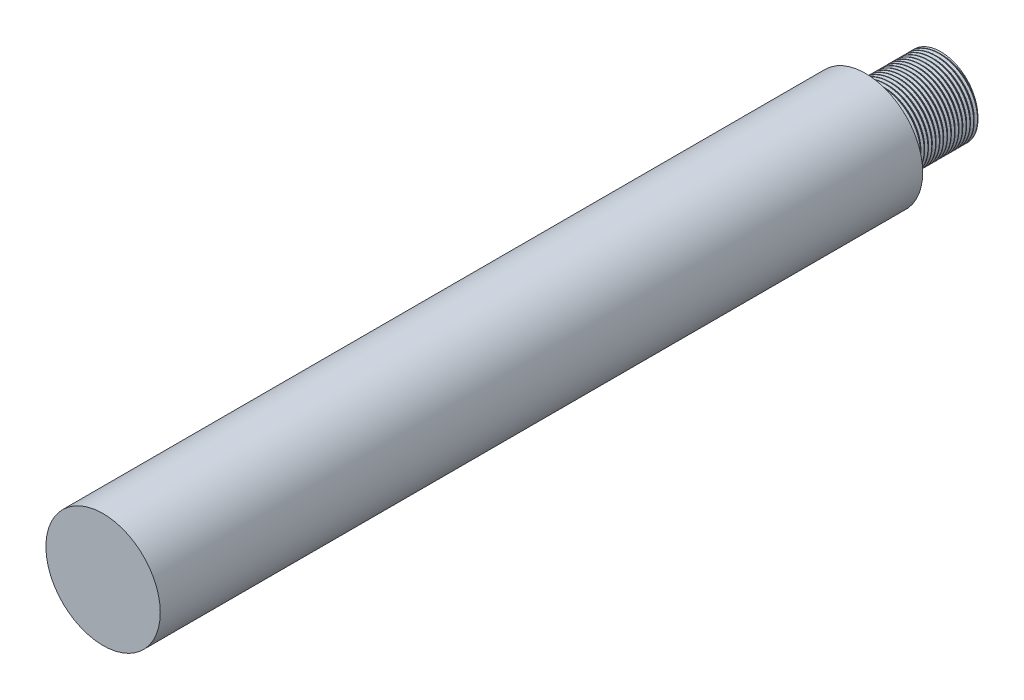
from build123d import *
from build123d.topology import SkipClean

# Parameters (mm, degrees)
SKETCH2_R           = 3.175
BOSS_EXTRUDE1_DEPTH = 6.35
THREAD1_PITCH       = 0.3175
SKETCH5_R           = 4.7625
SKETCH5_R_2         = 3.175
BOSS_EXTRUDE3_DEPTH = 63.5


with BuildPart() as part:
    # Sketch2 → Boss-Extrude1 (new body)
    with BuildSketch(Plane.XY):
        Circle(SKETCH2_R)
    extrude(amount=BOSS_EXTRUDE1_DEPTH)

    # Thread1: the profile of Thread Profile1 profile screwed along a right-hand helix of 20 turns, 6 arcs to a turn; built about Z, then put on its axis
    thread1_z = Axis((0, 0, 0), (0, 0, 1))
    thread1_corners = [(3.1753, 0, -0.000173205), (3.1753, 0, 0.277985704), (3.003148085, 0, 0.17859375), (3.003148085, 0, 0.09921875)]
    with BuildLine(mode=Mode.PRIVATE) as thread1_profile:
        Line(thread1_corners[0], thread1_corners[1])
        Line(thread1_corners[1], thread1_corners[2])
        Line(thread1_corners[2], thread1_corners[3])
        Line(thread1_corners[3], thread1_corners[0])
    thread1_cap = Face(thread1_profile.wire())
    thread1_turn_angles = [0, 30, 60, 90, 120, 150, 180, 210, 240, 270, 300, 330, 360]
    thread1_turn_weights = [1, 0.8660254037844387, 1, 0.8660254037844387, 1, 0.8660254037844387, 1, 0.8660254037844387, 1, 0.8660254037844387, 1, 0.8660254037844387, 1]
    thread1_turn_rails = [Edge.make_bspline([Vector(p[0], p[1], 0).rotate(thread1_z, thread1_turn_angles[k]) / thread1_turn_weights[k] + Vector(0, 0, p[2] + THREAD1_PITCH * thread1_turn_angles[k] / 360) for k in range(13)], [0, 0, 0, 1, 1, 2, 2, 3, 3, 4, 4, 5, 5, 6, 6, 6], 2, thread1_turn_weights) for p in thread1_corners]
    thread1_turn_sides = [Face.make_surface_from_curves(thread1_turn_rails[p[0]], thread1_turn_rails[p[1]]) for p in [(0, 1), (1, 2), (2, 3), (3, 0)]]
    thread1 = Plane(origin=(0, 0, 6.35), x_dir=(-1, 0, 0), z_dir=(0, 0, -1)) * Solid(Shell([*[p.moved(Location((0, 0, THREAD1_PITCH * i))) for i in range(20) for p in thread1_turn_sides], thread1_cap, thread1_cap.rotate(thread1_z, 7200).moved(Location((0, 0, THREAD1_PITCH * 7200 / 360)))]))
    add(thread1, mode=Mode.SUBTRACT)

    # Sketch5 → Boss-Extrude3 (add)
    # profile 1 of 2: a face of its own
    with SkipClean():  # the faces are left unmerged after this step: merging them gives an invalid solid
        with BuildSketch(Plane.XY.offset(6.35)):
            Circle(SKETCH5_R)
            Circle(SKETCH5_R_2, mode=Mode.SUBTRACT)
        # profile 2 of 2: a face of its own
        with BuildSketch(Plane.XY.offset(6.35)):
            Circle(SKETCH5_R_2)
        extrude(amount=BOSS_EXTRUDE3_DEPTH)


solid = part.part
